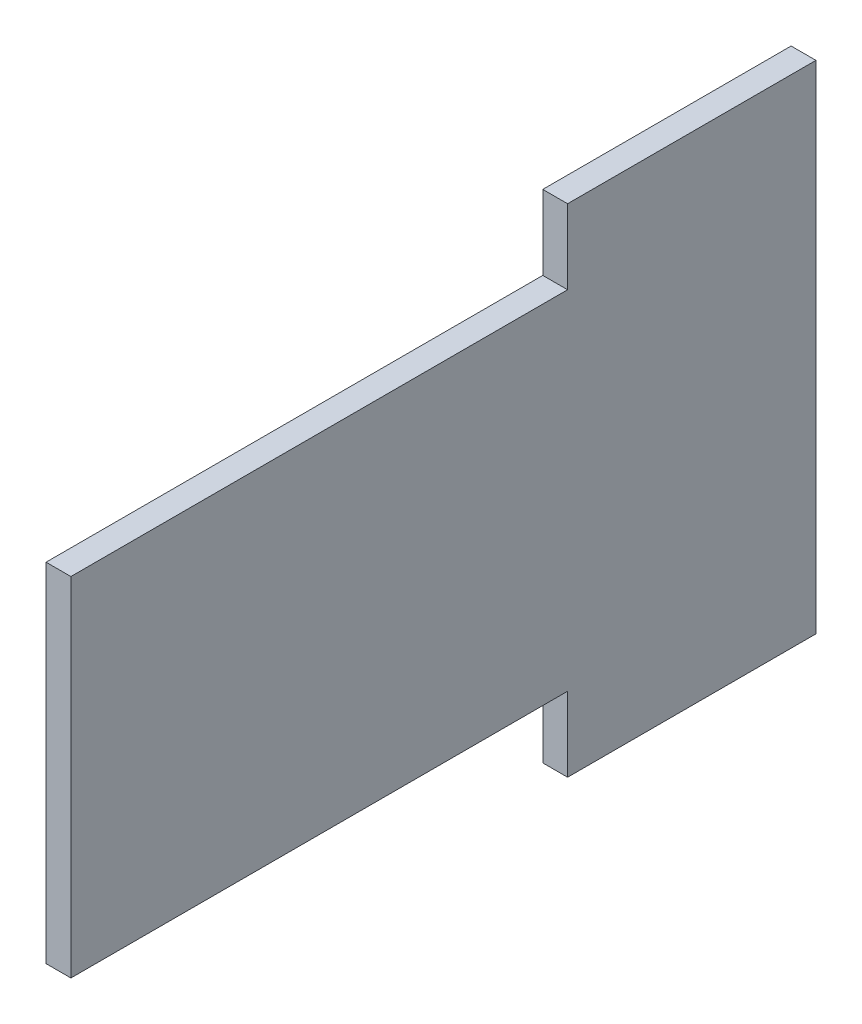
from build123d import *

# Parameters (mm, degrees)
BOSS_EXTRUDE1_DEPTH = 5


with BuildPart() as part:
    # Sketch1 → Boss-Extrude1 (new body)
    with BuildSketch(Plane.YZ):
        Polygon((50, 0), (50, 50), (35, 50), (35, 150), (-35, 150), (-35, 50), (-50, 50), (-50, 0), (0, 0), align=None)
    extrude(amount=BOSS_EXTRUDE1_DEPTH)


solid = part.part
